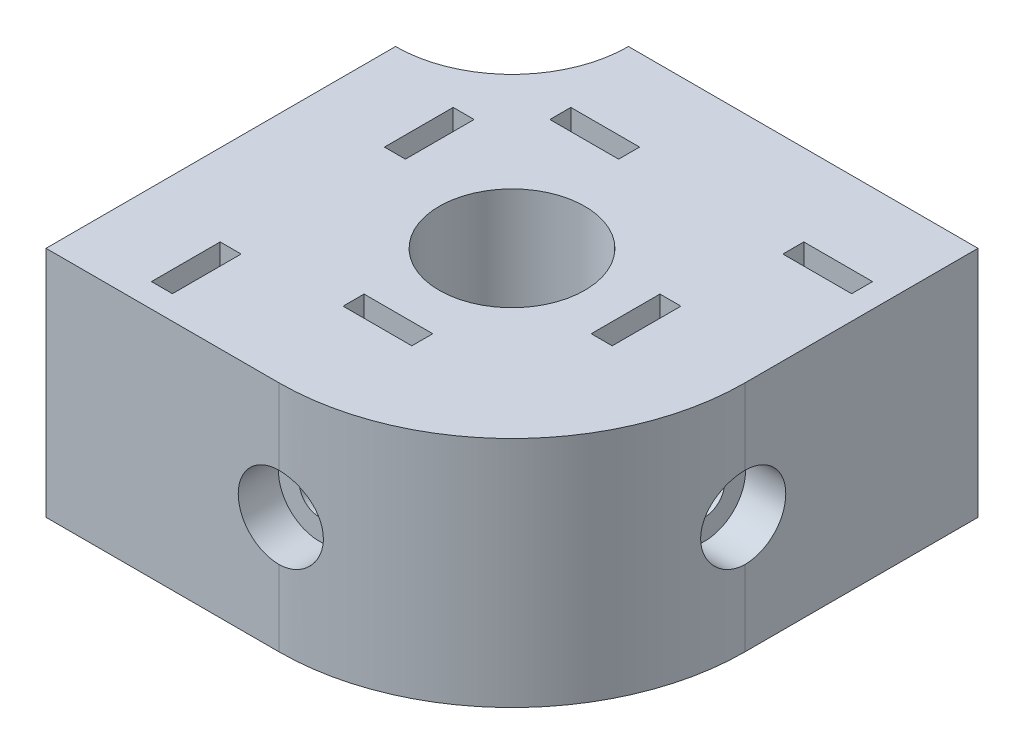
from build123d import *

# Parameters (mm, degrees)
SKETCH1_W               = 40
SKETCH1_H               = 40
SKETCH1_R               = 6.25
BOSS_EXTRUDE1_DEPTH     = 20
SKETCH2_R               = 1.7
CUT_EXTRUDE1_DEPTH      = 11
CUT_EXTRUDE2_START      = -7
CUT_EXTRUDE2_DEPTH      = 1.8
CUT_EXTRUDE3_REACH      = 50.99
CUT_EXTRUDE3_END_RADIUS = 6.25
SKETCH4_R               = 1.7
CUT_EXTRUDE4_START      = -8.45
CUT_EXTRUDE4_DEPTH      = 1.8
SKETCH6_R               = 3.5
CUT_EXTRUDE5_DEPTH      = 3.45
FILLET1_R               = 20
CUT_EXTRUDE6_DEPTH      = 35.641016325


with BuildPart() as part:
    # Sketch1 → Boss-Extrude1 (new body)
    with BuildSketch(Plane(origin=(0, 0, 0), x_dir=(1, 0, 0), z_dir=(0, 1, 0))):
        Rectangle(SKETCH1_W, SKETCH1_H)
        with Locations(Location((0, 0, 0), (0, 0, 270))):
            Circle(SKETCH1_R, mode=Mode.SUBTRACT)
    extrude(amount=BOSS_EXTRUDE1_DEPTH)

    # Sketch2 → Cut-Extrude1 (cut)
    with BuildSketch(Plane.ZY.offset(20)):
        with Locations((-5, 15)):
            Circle(SKETCH2_R)
        with Locations((15, 15)):
            Circle(SKETCH2_R)
        with Locations((0, 5)):
            Circle(SKETCH2_R)
    cut_extrude1 = extrude(amount=-CUT_EXTRUDE1_DEPTH, mode=Mode.SUBTRACT)

    # Sketch3 → Cut-Extrude2 (cut)
    with BuildSketch(Plane.ZY.offset(20).offset(CUT_EXTRUDE2_START)):
        Polygon((-7.95, 12.05), (-2.05, 12.05), (-2.05, 17.95), (-2.05, 20), (-7.95, 20), (-7.95, 17.95), align=None)
        Polygon((12.05, 12.05), (17.95, 12.05), (17.95, 17.95), (17.95, 20), (12.05, 20), (12.05, 17.95), align=None)
        Polygon((-2.95, 7.95), (2.95, 7.95), (2.95, 2.05), (2.95, 0), (-2.95, 0), (-2.95, 2.05), align=None)
    cut_extrude2 = extrude(amount=-CUT_EXTRUDE2_DEPTH, mode=Mode.SUBTRACT)

    # Cut-Extrude3: up to this cylinder (the profile starts outside it)
    cut_extrude3_end = Plane(origin=(0, 10, 0), z_dir=(0, -1, 0)) * Cylinder(CUT_EXTRUDE3_END_RADIUS, 115.48, mode=Mode.PRIVATE)
    # Sketch4 → Cut-Extrude3 (cut, up to the surface)
    with BuildSketch(Plane.XY.offset(20), mode=Mode.PRIVATE) as cut_extrude3_sk1:
        with Locations((0, 10)):
            Circle(SKETCH4_R)
    cut_extrude3_tool1 = extrude(cut_extrude3_sk1.sketch, amount=-CUT_EXTRUDE3_REACH, mode=Mode.PRIVATE) - cut_extrude3_end
    cut_extrude3 = cut_extrude3_tool1.solids().sort_by_distance((0, 10, 20))[0]
    add(cut_extrude3, mode=Mode.SUBTRACT)

    # Sketch5 → Cut-Extrude4 (cut)
    with BuildSketch(Plane.XY.offset(20).offset(CUT_EXTRUDE4_START)):
        Polygon((-2.95, 12.95), (-2.95, 20), (2.95, 20), (2.95, 12.95), (2.95, 7.05), (-2.95, 7.05), align=None)
    cut_extrude4 = extrude(amount=-CUT_EXTRUDE4_DEPTH, mode=Mode.SUBTRACT)

    # Sketch6 → Cut-Extrude5 (cut)
    with BuildSketch(Plane.XY.offset(20)):
        with Locations((0, 10)):
            Circle(SKETCH6_R)
    cut_extrude5 = extrude(amount=-CUT_EXTRUDE5_DEPTH, mode=Mode.SUBTRACT)

    # Mirror1: Cut-Extrude1, Cut-Extrude2, Cut-Extrude3, Cut-Extrude4, Cut-Extrude5 across plane
    add(cut_extrude1.mirror(Plane(origin=(0, 0, 0), x_dir=(0.7071067811865476, 0, 0.7071067811865476), z_dir=(-0.7071067811865477, 0, 0.7071067811865475))), mode=Mode.SUBTRACT)
    add(cut_extrude2.mirror(Plane(origin=(0, 0, 0), x_dir=(0.7071067811865476, 0, 0.7071067811865476), z_dir=(-0.7071067811865477, 0, 0.7071067811865475))), mode=Mode.SUBTRACT)
    add(cut_extrude3.mirror(Plane(origin=(0, 0, 0), x_dir=(0.7071067811865476, 0, 0.7071067811865476), z_dir=(-0.7071067811865477, 0, 0.7071067811865475))), mode=Mode.SUBTRACT)
    add(cut_extrude4.mirror(Plane(origin=(0, 0, 0), x_dir=(0.7071067811865476, 0, 0.7071067811865476), z_dir=(-0.7071067811865477, 0, 0.7071067811865475))), mode=Mode.SUBTRACT)
    add(cut_extrude5.mirror(Plane(origin=(0, 0, 0), x_dir=(0.7071067811865476, 0, 0.7071067811865476), z_dir=(-0.7071067811865477, 0, 0.7071067811865475))), mode=Mode.SUBTRACT)

    # Fillet1
    # the kernel refuses this fillet: 20 mm, written as the material it takes off along each edge
    with BuildSketch(Plane(origin=(20, -50, 20), x_dir=(-1, 0, 0), z_dir=(0, 1, 0))) as fillet1_piece_1:
        with BuildLine():
            CenterArc((FILLET1_R, -FILLET1_R), FILLET1_R, 90, 90)
            Line((0, -FILLET1_R), (0, 0))
            Line((0, 0), (FILLET1_R, 0))
        make_face()
    extrude(amount=120, mode=Mode.SUBTRACT)

    # Sketch7 → Cut-Extrude6 (cut, through all)
    with BuildSketch(Plane(origin=(0, 20, 0), x_dir=(1, 0, 0), z_dir=(0, 1, 0))):
        with BuildLine():
            Line((-20, 10), (-20, 20))
            Line((-20, 20), (-10, 20))
            ThreePointArc((-10, 20), (-12.928932188, 12.928932188), (-20, 10))
        make_face()
    extrude(amount=-CUT_EXTRUDE6_DEPTH, mode=Mode.SUBTRACT)


solid = part.part
